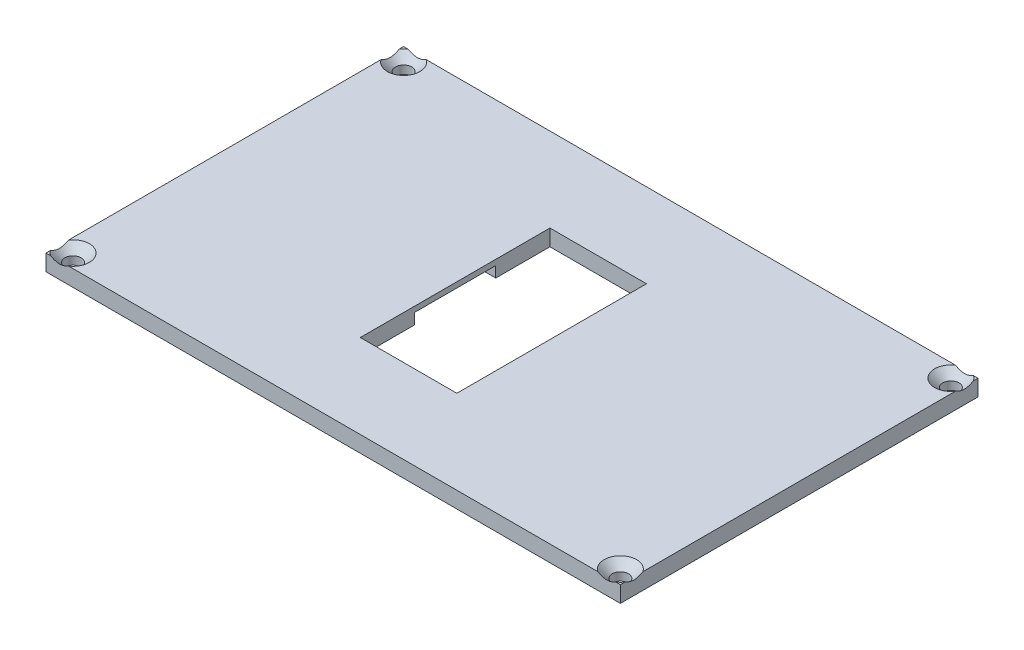
from build123d import *

# Parameters (mm, degrees)
CROQUIS1_W              = 106
CROQUIS1_H              = 66
SALIENTE_EXTRUIR1_DEPTH = 3
CROQUIS2_W              = 17.819535579
CROQUIS2_H              = 35
CORTAR_EXTRUIR1_DEPTH   = 3
CROQUIS3_W              = 6
CROQUIS3_H              = 11
CROQUIS3_H_2            = 15
CORTAR_EXTRUIR2_DEPTH   = 2
CROQUIS4_R              = 1.5
CORTAR_EXTRUIR3_DEPTH   = 4
CHAFL_N1_SIZE           = 1.5


with BuildPart() as part:
    # Croquis1 → Saliente-Extruir1 (new body)
    with BuildSketch(Plane(origin=(0, 0, 0), x_dir=(1, 0, 0), z_dir=(0, 1, 0))):
        with Locations((10.650118203, -3.555555556)):
            Rectangle(CROQUIS1_W, CROQUIS1_H)
    extrude(amount=SALIENTE_EXTRUIR1_DEPTH)

    # Croquis2 → Cortar-Extruir1 (cut)
    with BuildSketch(Plane(origin=(0, 3, 0), x_dir=(1, 0, 0), z_dir=(0, 1, 0))):
        with Locations((9.059885993, -3.555555556)):
            Rectangle(CROQUIS2_W, CROQUIS2_H)
    extrude(amount=-CORTAR_EXTRUIR1_DEPTH, mode=Mode.SUBTRACT)

    # Croquis3 → Cortar-Extruir2 (cut)
    with BuildSketch(Plane.XZ):
        with Locations((20.969653782, 3.555555556)):
            Rectangle(CROQUIS3_W, CROQUIS3_H)
        with Locations((-2.849881797, 3.555555556)):
            Rectangle(CROQUIS3_W, CROQUIS3_H_2)
    extrude(amount=-CORTAR_EXTRUIR2_DEPTH, mode=Mode.SUBTRACT)

    # Croquis4 → Cortar-Extruir3 (cut)
    with BuildSketch(Plane(origin=(0, 3, 0), x_dir=(1, 0, 0), z_dir=(0, 1, 0))):
        with Locations(Location((-39.849881797, 26.944444444, 0), (0, 0, 270))):
            Circle(CROQUIS4_R)
        with Locations(Location((61.150118203, 26.944444444, 0), (0, 0, 270))):
            Circle(CROQUIS4_R)
        with Locations(Location((61.150118203, -34.055555556, 0), (0, 0, 270))):
            Circle(CROQUIS4_R)
        with Locations(Location((-39.849881797, -34.055555556, 0), (0, 0, 270))):
            Circle(CROQUIS4_R)
    extrude(amount=-CORTAR_EXTRUIR3_DEPTH, mode=Mode.SUBTRACT)

    # Chaflán1
    # the kernel refuses this chamfer: 1.5 mm, written as the material it takes off along each edge
    with BuildSketch(Plane(origin=(-39.849881797, 3, 34.055555556), x_dir=(0, 0, 1), z_dir=(-1, 0, 0))) as chafl_n1_piece_1:
        Polygon((1.5 + CHAFL_N1_SIZE, 0), (1.5, -CHAFL_N1_SIZE), (1.5, 0), align=None)
    revolve(axis=Axis((-39.849881797, 3, 34.055555556), (0, 1, 0)), mode=Mode.SUBTRACT)
    with BuildSketch(Plane(origin=(61.150118203, 3, 34.055555556), x_dir=(0, 0, 1), z_dir=(-1, 0, 0))) as chafl_n1_piece_2:
        Polygon((1.5 + CHAFL_N1_SIZE, 0), (1.5, -CHAFL_N1_SIZE), (1.5, 0), align=None)
    revolve(axis=Axis((61.150118203, 3, 34.055555556), (0, 1, 0)), mode=Mode.SUBTRACT)
    with BuildSketch(Plane(origin=(61.150118203, 3, -26.944444444), x_dir=(0, 0, 1), z_dir=(-1, 0, 0))) as chafl_n1_piece_3:
        Polygon((1.5 + CHAFL_N1_SIZE, 0), (1.5, -CHAFL_N1_SIZE), (1.5, 0), align=None)
    revolve(axis=Axis((61.150118203, 3, -26.944444444), (0, 1, 0)), mode=Mode.SUBTRACT)
    with BuildSketch(Plane(origin=(-39.849881797, 3, -26.944444444), x_dir=(0, 0, 1), z_dir=(-1, 0, 0))) as chafl_n1_piece_4:
        Polygon((1.5 + CHAFL_N1_SIZE, 0), (1.5, -CHAFL_N1_SIZE), (1.5, 0), align=None)
    revolve(axis=Axis((-39.849881797, 3, -26.944444444), (0, 1, 0)), mode=Mode.SUBTRACT)


solid = part.part
